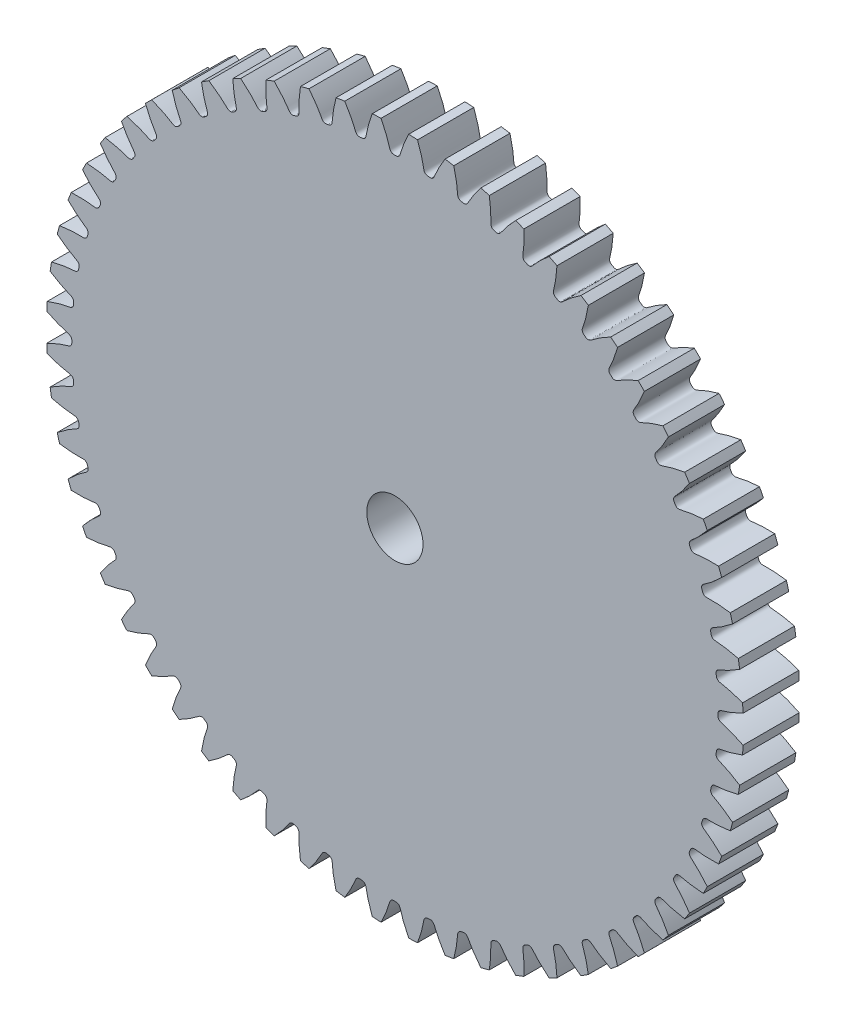
from build123d import *

# Parameters (mm, degrees)
SKETCHREVOLVESPURGEAR1_W       = 10
SKETCHREVOLVESPURGEAR1_H       = 62
TOOTHEXTRUDECUTSPURGEAR1_DEPTH = 5
PATTERNSPURGEAR1_COUNT         = 60
BOREREVOLVESKETCH_W            = 10
BOREREVOLVESKETCH_H            = 5


with BuildPart() as part:
    # SketchRevolveSpurGear1 → SpurGear1 (revolve)
    with BuildSketch(Plane(origin=(0, 0, 0), x_dir=(0, 0, -1), z_dir=(1, 0, 0))):
        with Locations((0, 31)):
            Rectangle(SKETCHREVOLVESPURGEAR1_W, SKETCHREVOLVESPURGEAR1_H)
    revolve(axis=Axis((0, 0, 0), (0, 0, -1)))

    # SketchToothSpurGear1 → ToothExtrudeCutSpurGear1 (cut, symmetric)
    with BuildSketch(Plane.XY):
        with BuildLine():
            ThreePointArc((62.049256783, 2.509926834), (62.1, 0), (62.049256783, -2.509926834))
            add(Edge.make_bspline(
                [(62.049256783, -2.509926834), (61.880775293, -2.423720466), (61.62979539, -2.298732896), (61.296629681, -2.139816131), (61.055025198, -2.027870002), (60.818608258, -1.921520187), (60.587472974, -1.820636408), (60.361711191, -1.725086953), (60.141412457, -1.634738783), (59.926664047, -1.549457444), (59.717550792, -1.469107494), (59.514155604, -1.393551159), (59.316557525, -1.32265327), (59.124838573, -1.256263887), (58.939059412, -1.194280068), (58.75934535, -1.136427465), (58.585582583, -1.083031778), (58.340486602, -1.008618016), (58.121550474, -0.958050264), (57.942578605, -0.880548972), (57.862638245, -0.837879974), (57.777683853, -0.780806557), (57.686308036, -0.699856643), (57.593276173, -0.58150613), (57.520014071, -0.420535316), (57.492131045, -0.218013552), (57.504286767, 0), (57.492131045, 0.218013552), (57.520014071, 0.420535316), (57.593276173, 0.58150613), (57.686308036, 0.699856643), (57.777683853, 0.780806557), (57.862638245, 0.837879974), (57.942578605, 0.880548972), (58.121550474, 0.958050264), (58.340486602, 1.008618016), (58.585582583, 1.083031778), (58.75934535, 1.136427465), (58.939059412, 1.194280068), (59.124838573, 1.256263887), (59.316557525, 1.32265327), (59.514155604, 1.393551159), (59.717550792, 1.469107494), (59.926664047, 1.549457444), (60.141412457, 1.634738783), (60.361711191, 1.725086953), (60.587472974, 1.820636408), (60.818608258, 1.921520187), (61.055025198, 2.027870002), (61.296629681, 2.139816131), (61.62979539, 2.298732896), (61.880775293, 2.423720466), (62.049256783, 2.509926834)],
                knots=[0, 0, 0, 0, 0.05176586, 0.076685537, 0.100963046, 0.124598386, 0.147591557, 0.16994256, 0.191651394, 0.21271806, 0.233142557, 0.252924885, 0.272065045, 0.290563036, 0.308418859, 0.325632513, 0.342203998, 0.358133315, 0.395728589, 0.403326908, 0.411414611, 0.420483419, 0.431260975, 0.444674611, 0.46138654, 0.478964563, 0.5, 0.521035437, 0.53861346, 0.555325389, 0.568739025, 0.579516581, 0.588585389, 0.596673092, 0.604271411, 0.641866685, 0.657796002, 0.674367487, 0.691581141, 0.709436964, 0.727934955, 0.747075115, 0.766857443, 0.78728194, 0.808348606, 0.83005744, 0.852408443, 0.875401614, 0.899036954, 0.923314463, 0.94823414, 1, 1, 1, 1], degree=3))
        make_face()
    toothextrudecutspurgear1 = extrude(amount=TOOTHEXTRUDECUTSPURGEAR1_DEPTH, both=True, mode=Mode.SUBTRACT)

    # PatternSpurGear1: ToothExtrudeCutSpurGear1 ×60 about axis
    patternspurgear1_axis = Axis((0, 0, 55), (0, 0, -1))
    for i in range(1, PATTERNSPURGEAR1_COUNT):
        add(toothextrudecutspurgear1.rotate(patternspurgear1_axis, i * 360 / PATTERNSPURGEAR1_COUNT), mode=Mode.SUBTRACT)

    # BoreRevolveSketch → BoreRevolveCut (revolve, cut)
    with BuildSketch(Plane(origin=(0, 0, 0), x_dir=(0, 0, -1), z_dir=(1, 0, 0))):
        with Locations((0, 2.5)):
            Rectangle(BOREREVOLVESKETCH_W, BOREREVOLVESKETCH_H)
    revolve(axis=Axis((0, 0, 0), (0, 0, -1)), mode=Mode.SUBTRACT)


solid = part.part
